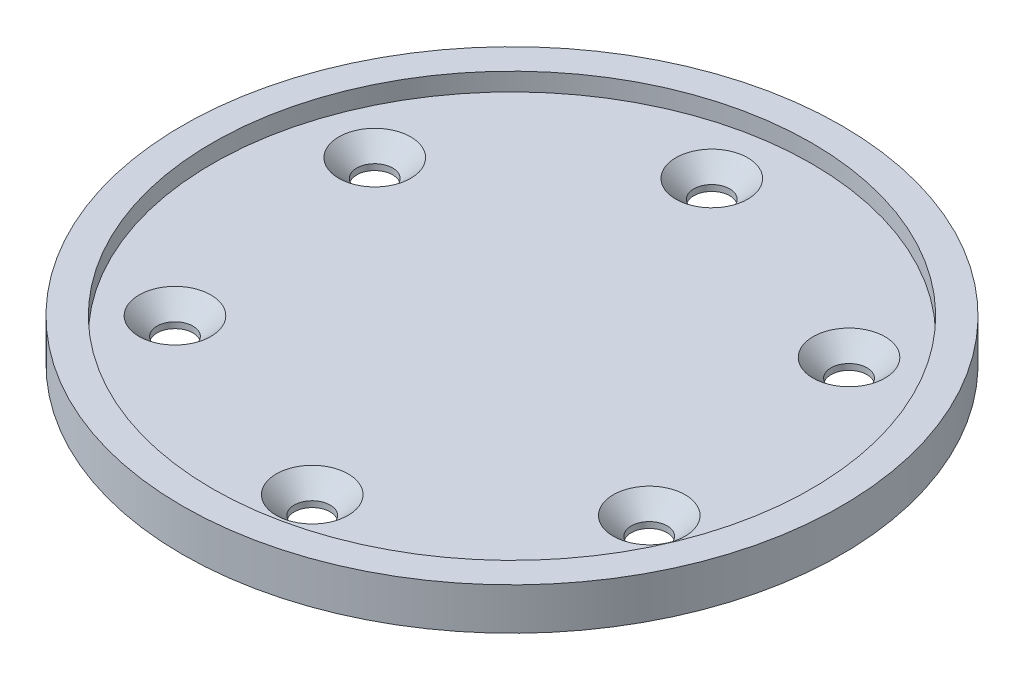
from build123d import *

# Parameters (mm, degrees)
SKETCH2_R          = 3
CUT_EXTRUDE1_DEPTH = 78.884529914
CHAMFER1_SIZE      = 3


with BuildPart() as part:
    # Sketch1 → Revolve1 (revolve)
    with BuildSketch(Plane.XY):
        Polygon((50, 3.478641915), (50, 6.478641915), (55, 6.478641915), (55, -0.521358085), (0, -0.521358085), (0, 3.478641915), align=None)
    revolve(axis=Axis((0, 0, 0), (0, 1, 0)))

    # Sketch2 → Cut-Extrude1 (cut, through all)
    with BuildSketch(Plane(origin=(0, 3.478641915, 0), x_dir=(1, 0, 0), z_dir=(0, 1, 0))):
        with Locations((-6.177388612, 39.520119812)):
            Circle(SKETCH2_R)
        with Locations((-37.314122023, 14.410284439)):
            Circle(SKETCH2_R)
        with Locations((-31.136733412, -25.109835373)):
            Circle(SKETCH2_R)
        with Locations((6.177388612, -39.520119812)):
            Circle(SKETCH2_R)
        with Locations((37.314122023, -14.410284439)):
            Circle(SKETCH2_R)
        with Locations((31.136733412, 25.109835373)):
            Circle(SKETCH2_R)
    extrude(amount=-CUT_EXTRUDE1_DEPTH, mode=Mode.SUBTRACT)

    # Chamfer1
    chamfer1_edges = [part.edges().sort_by_distance(p)[0] for p in [
        (28.136733412, 3.478641915, -25.109835373),
        (34.314122023, 3.478641915, 14.410284439),
        (-34.136733412, 3.478641915, 25.109835373),
        (-40.314122023, 3.478641915, -14.410284439),
        (-9.177388612, 3.478641915, -39.520119812),
        (3.177388612, 3.478641915, 39.520119812),
    ]]
    chamfer(chamfer1_edges, length=CHAMFER1_SIZE)


solid = part.part
